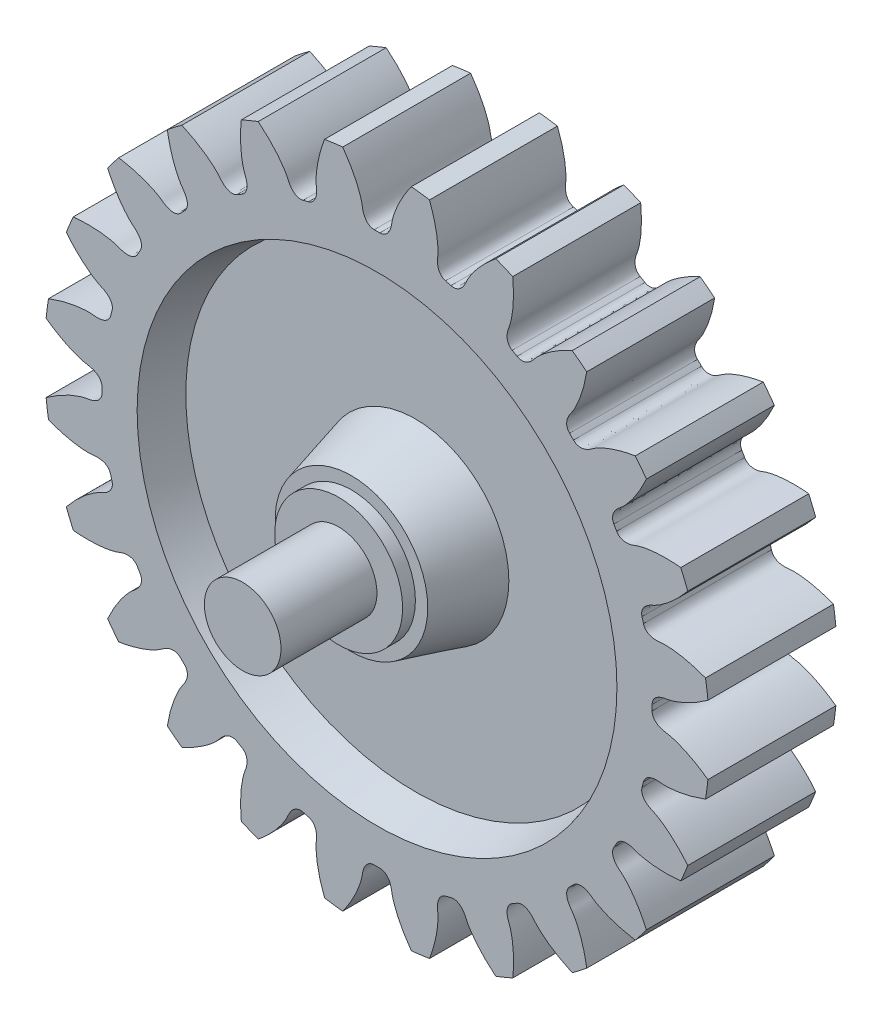
from build123d import *

# Parameters (mm, degrees)
GEAR_BASESKETCH_R         = 52
GEARMODULE_DEPTH          = 10
TOOTH_CUT_DEPTH           = 75.215901261
TOOTH_PATTERN_24_24_COUNT = 24
SKETCH4_R                 = 37.5
SKETCH4_R_2               = 13
CUT_EXTRUDE2_DEPTH        = 6
CUT_EXTRUDE2_DRAFT        = -15
MIRROR1_COPY_1_SKETCH_R   = 37.5
MIRROR1_COPY_1_SKETCH_R_2 = 13
MIRROR1_COPY_1_DEPTH      = 6
MIRROR1_COPY_1_DRAFT      = -15
SKETCH8_R                 = 13
BOSS_EXTRUDE3_DEPTH       = 4
BOSS_EXTRUDE3_TAPER       = 15
SKETCH10_R                = 10
BOSS_EXTRUDE5_DEPTH       = 12
SKETCH11_R                = 5.99
BOSS_EXTRUDE6_DEPTH       = 15
CUT_EXTRUDE5_DEPTH        = 15


with BuildPart() as part:
    # Gear-BaseSketch → GearModule (new, symmetric)
    with BuildSketch(Plane.XY):
        Circle(GEAR_BASESKETCH_R)
    extrude(amount=GEARMODULE_DEPTH, both=True)

    # Tooth-Sketch; Backlash: 0,0000mm → Tooth-Cut (cut, symmetric)
    with BuildSketch(Plane.XY):
        with BuildLine():
            ThreePointArc((-5.430450059, 51.811307567), (0, 52.095118578), (5.430450059, 51.811307567))
            add(Edge.make_bspline(
                [(5.430450059, 51.811307567), (5.063197008, 51.305844046), (4.557892782, 50.555642736), (3.968267258, 49.555949015), (3.602870165, 48.878139821), (3.293279899, 48.246904429), (3.035323161, 47.665446765), (2.824670301, 47.136716056), (2.656825665, 46.663402538), (2.527220194, 46.247920427), (2.430987493, 45.892432523), (2.363668146, 45.598755697), (2.317228011, 45.357696229), (2.291570366, 45.174965293), (2.267294694, 45.031833237), (2.245182767, 44.91756655), (2.205102163, 44.734196148), (2.137922996, 44.486483329), (2.024869006, 44.180633646), (1.878580844, 43.887399013), (1.683916271, 43.602610321), (1.415237423, 43.330168991), (1.00276289, 43.07249566), (0.643458961, 42.998685279), (0.431329694, 42.997836628)],
                knots=[0, 0, 0, 0, 0.177934354, 0.257369334, 0.330449516, 0.397174901, 0.457545487, 0.511561275, 0.559222266, 0.600528459, 0.635479855, 0.664076455, 0.686318258, 0.705366715, 0.71661716, 0.727659528, 0.73850861, 0.770069565, 0.800665421, 0.831227308, 0.863172332, 0.898518224, 0.939478068, 1, 1, 1, 1], degree=3))
            ThreePointArc((0.431329694, 42.997836628), (0, 43), (-0.431329694, 42.997836628))
            add(Edge.make_bspline(
                [(-5.430450059, 51.811307567), (-5.063197008, 51.305844046), (-4.557892782, 50.555642736), (-3.968267258, 49.555949015), (-3.602870165, 48.878139821), (-3.293279899, 48.246904429), (-3.035323161, 47.665446765), (-2.824670301, 47.136716056), (-2.656825665, 46.663402538), (-2.527220194, 46.247920427), (-2.430987493, 45.892432523), (-2.363668146, 45.598755697), (-2.317228011, 45.357696229), (-2.291570366, 45.174965293), (-2.267294694, 45.031833237), (-2.245182767, 44.91756655), (-2.205102163, 44.734196148), (-2.137922996, 44.486483329), (-2.024869006, 44.180633646), (-1.878580844, 43.887399013), (-1.683916271, 43.602610321), (-1.415237423, 43.330168991), (-1.00276289, 43.07249566), (-0.643458961, 42.998685279), (-0.431329694, 42.997836628)],
                knots=[0, 0, 0, 0, 0.177934354, 0.257369334, 0.330449516, 0.397174901, 0.457545487, 0.511561275, 0.559222266, 0.600528459, 0.635479855, 0.664076455, 0.686318258, 0.705366715, 0.71661716, 0.727659528, 0.73850861, 0.770069565, 0.800665421, 0.831227308, 0.863172332, 0.898518224, 0.939478068, 1, 1, 1, 1], degree=3))
        make_face()
    tooth_cut = extrude(amount=TOOTH_CUT_DEPTH, both=True, mode=Mode.SUBTRACT)

    # Tooth Pattern, 24 / 24: Tooth-Cut ×24 about axis
    tooth_pattern_24_24_axis = Axis((0, 0, -88.99), (0, 0, 1))
    for i in range(1, TOOTH_PATTERN_24_24_COUNT):
        add(tooth_cut.rotate(tooth_pattern_24_24_axis, i * 360 / TOOTH_PATTERN_24_24_COUNT), mode=Mode.SUBTRACT)


with BuildPart() as cut_extrude2_tool:
    # Sketch4 → Cut-Extrude2 (with draft: the straight prism first)
    with BuildSketch(Plane.XY.offset(10)):
        Circle(SKETCH4_R)
        Circle(SKETCH4_R_2, mode=Mode.SUBTRACT)
    extrude(amount=-CUT_EXTRUDE2_DEPTH)
    # Cut-Extrude2: the draft: its side faces are tilted about the plane it starts from
    cut_extrude2_sides = [cut_extrude2_tool.faces().sort_by_distance(p)[0] for p in [
        (-37.5, 0, 7),
        (-13, 0, 7),
    ]]
    draft(cut_extrude2_sides, Plane.XY.offset(10), CUT_EXTRUDE2_DRAFT)


with BuildPart() as part_1:
    add(part.part)

    # Cut-Extrude2: cut by cut_extrude2_tool
    add(cut_extrude2_tool.part, mode=Mode.SUBTRACT)


with BuildPart() as mirror1_copy_1_tool:
    # Mirror1 copy 1 sketch → Mirror1 copy 1 (with draft: the straight prism first)
    with BuildSketch(Plane(origin=(0, 0, -10), x_dir=(1, 0, 0), z_dir=(0, 0, -1))):
        Circle(MIRROR1_COPY_1_SKETCH_R)
        Circle(MIRROR1_COPY_1_SKETCH_R_2, mode=Mode.SUBTRACT)
    extrude(amount=-MIRROR1_COPY_1_DEPTH)
    # Mirror1 copy 1: the draft: its side faces are tilted about the plane it starts from
    mirror1_copy_1_sides = [mirror1_copy_1_tool.faces().sort_by_distance(p)[0] for p in [
        (-37.5, 0, -7),
        (-13, 0, -7),
    ]]
    draft(mirror1_copy_1_sides, Plane(origin=(0, 0, -10), x_dir=(1, 0, 0), z_dir=(0, 0, -1)), MIRROR1_COPY_1_DRAFT)


with BuildPart() as part_2:
    add(part_1.part)

    # Mirror1 copy 1: cut by mirror1_copy_1_tool
    add(mirror1_copy_1_tool.part, mode=Mode.SUBTRACT)

    # Sketch8 → Boss-Extrude3 (add)
    with BuildSketch(Plane.XY.offset(10)):
        Circle(SKETCH8_R)
    boss_extrude3 = extrude(amount=BOSS_EXTRUDE3_DEPTH, taper=BOSS_EXTRUDE3_TAPER)

    # Mirror3: Boss-Extrude3 across plane
    add(boss_extrude3.mirror(Plane.XY))

    # Sketch10 → Boss-Extrude5 (add)
    with BuildSketch(Plane.XY.offset(4)):
        Circle(SKETCH10_R)
    extrude(amount=BOSS_EXTRUDE5_DEPTH)

    # Sketch11 → Boss-Extrude6 (add)
    with BuildSketch(Plane.XY.offset(16)):
        Circle(SKETCH11_R)
    extrude(amount=BOSS_EXTRUDE6_DEPTH)

    # Sketch9 → Cut-Extrude5 (cut, symmetric)
    with BuildSketch(Plane.XY):
        with BuildLine():
            Line((-2, 8.5), (2, 8.5))
            Line((2, 8.5), (2, 6.708203932))
            ThreePointArc((2, 6.708203932), (0, -7), (-2, 6.708203932))
            Line((-2, 6.708203932), (-2, 8.5))
        make_face()
    extrude(amount=CUT_EXTRUDE5_DEPTH, both=True, mode=Mode.SUBTRACT)


solid = part_2.part
